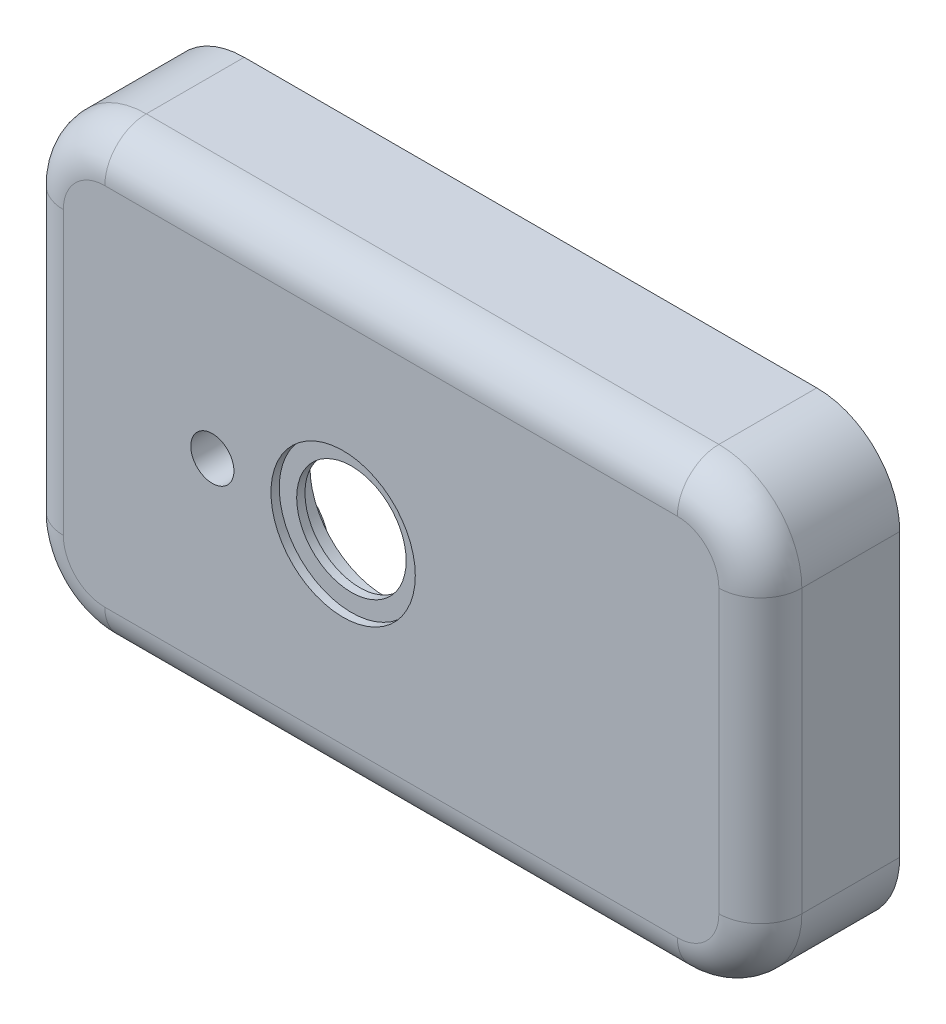
from build123d import *

# Parameters (mm, degrees)
BOSS_EXTRUDE1_DEPTH   = 14.8
BOSS_EXTRUDE1_2_DEPTH = 14.8
BOSS_EXTRUDE2_DEPTH   = 5
SKETCH3_W             = 5
SKETCH3_H             = 14.8
BOSS_EXTRUDE3_DEPTH   = 12
BOSS_EXTRUDE4_DEPTH   = 2
BOSS_EXTRUDE5_DEPTH   = 3
CUT_EXTRUDE1_DEPTH    = 10
FILLET1_R             = 5
SKETCH8_R             = 1.75
BOSS_EXTRUDE6_DEPTH   = 11.8
SKETCH9_R             = 1.75
CUT_EXTRUDE2_DEPTH    = 7
SKETCH10_R            = 2.75
CUT_EXTRUDE3_DEPTH    = 3.5
CUT_EXTRUDE4_DEPTH    = 9.5
CUT_EXTRUDE5_DEPTH    = 9.5
CUT_EXTRUDE6_DEPTH    = 2
SKETCH14_R            = 9
CUT_EXTRUDE7_DEPTH    = 3
CUT_EXTRUDE8_DEPTH    = 2
CHAMFER1_SIZE         = 5
CHAMFER2_SIZE         = 5
CHAMFER3_SIZE         = 5
CHAMFER4_SIZE         = 5
SKETCH16_W            = 31.273628052
SKETCH16_H            = 22.8
CUT_EXTRUDE9_DEPTH    = 4
SKETCH17_R            = 8.7
CUT_EXTRUDE10_DEPTH   = 1


with BuildPart() as part:
    # Sketch1 → Boss-Extrude1 (new body)
    with BuildSketch(Plane.XY):
        with BuildLine():
            Line((76.198643796, 78.202901291), (7.183009885, 78.202901291))
            ThreePointArc((7.183009885, 78.202901291), (0.111942073, 75.273969103), (-2.816990115, 68.202901291))
            Line((-2.816990115, 68.202901291), (-2.816990115, 55.811342077))
            Line((-2.816990115, 55.811342077), (2.183009885, 55.811342077))
            Line((2.183009885, 55.811342077), (2.183009885, 73.202901291))
            Line((2.183009885, 73.202901291), (81.198643796, 73.202901291))
            Line((81.198643796, 73.202901291), (81.198643796, 55.202901291))
            Line((81.198643796, 55.202901291), (86.198643796, 55.202901291))
            Line((86.198643796, 55.202901291), (86.198643796, 68.202901291))
            ThreePointArc((86.198643796, 68.202901291), (83.269711608, 75.273969103), (76.198643796, 78.202901291))
        make_face()
    extrude(amount=BOSS_EXTRUDE1_DEPTH)



with BuildPart() as body_2:
    # Sketch1 → Boss-Extrude1 2 (new body)
    with BuildSketch(Plane.XY):
        with BuildLine():
            Line((7.183009885, 24.202901291), (76.198643796, 24.202901291))
            ThreePointArc((76.198643796, 24.202901291), (83.269711608, 27.131833479), (86.198643796, 34.202901291))
            Line((86.198643796, 34.202901291), (86.198643796, 47.202901291))
            Line((86.198643796, 47.202901291), (81.198643796, 47.202901291))
            Line((81.198643796, 47.202901291), (81.198643796, 29.202901291))
            Line((81.198643796, 29.202901291), (2.183009885, 29.202901291))
            Line((2.183009885, 29.202901291), (2.183009885, 46.611342077))
            Line((2.183009885, 46.611342077), (-2.816990115, 46.611342077))
            Line((-2.816990115, 46.611342077), (-2.816990115, 34.202901291))
            ThreePointArc((-2.816990115, 34.202901291), (0.111942073, 27.131833479), (7.183009885, 24.202901291))
        make_face()
    extrude(amount=BOSS_EXTRUDE1_2_DEPTH)


with BuildPart() as part_1:
    add(part.part)

    add(body_2.part)  # Boss-Extrude2 merges body 2
    # Sketch2 → Boss-Extrude2 (add)
    with BuildSketch(Plane.ZY.offset(2.816990115)):
        with BuildLine():
            ThreePointArc((0, 46.611342077), (4.6, 51.211342077), (0, 55.811342077))
            Line((0, 55.811342077), (14.8, 55.811342077))
            Line((14.8, 55.811342077), (14.8, 46.611342077))
            Line((14.8, 46.611342077), (0, 46.611342077))
        make_face()
    extrude(amount=-BOSS_EXTRUDE2_DEPTH)

    # Sketch3 → Boss-Extrude3 (add)
    with BuildSketch(Plane(origin=(0, 47.202901291, 0), x_dir=(1, 0, 0), z_dir=(0, 1, 0))):
        with Locations((83.698643796, -7.4)):
            Rectangle(SKETCH3_W, SKETCH3_H)
    extrude(amount=BOSS_EXTRUDE3_DEPTH)

    # Sketch4 → Boss-Extrude4 (add)
    with BuildSketch(Plane.XY.offset(14.8)):
        with BuildLine():
            Line((86.198643796, 34.202901291), (86.198643796, 68.202901291))
            ThreePointArc((86.198643796, 68.202901291), (83.269711608, 75.273969103), (76.198643796, 78.202901291))
            Line((76.198643796, 78.202901291), (7.183009885, 78.202901291))
            ThreePointArc((7.183009885, 78.202901291), (0.111942073, 75.273969103), (-2.816990115, 68.202901291))
            Line((-2.816990115, 68.202901291), (-2.816990115, 34.202901291))
            ThreePointArc((-2.816990115, 34.202901291), (0.111942073, 27.131833479), (7.183009885, 24.202901291))
            Line((7.183009885, 24.202901291), (76.198643796, 24.202901291))
            ThreePointArc((76.198643796, 24.202901291), (83.269711608, 27.131833479), (86.198643796, 34.202901291))
        make_face()
    extrude(amount=BOSS_EXTRUDE4_DEPTH)

    # Sketch6 → Boss-Extrude5 (add)
    with BuildSketch(Plane(origin=(0, 0, 14.8), x_dir=(-1, 0, 0), z_dir=(0, 0, -1))):
        Polygon((-16.183009885, 58.202901291), (-2.183009885, 58.202901291), (-2.183009885, 73.202901291), (-81.198643796, 73.202901291), (-81.198643796, 59.527901291), (-80.198643796, 59.527901291), (-79.792394453, 59.527901291), (-54.598643796, 59.527901291), (-54.598643796, 42.877901291), (-80.198643796, 42.877901291), (-81.198643796, 42.877901291), (-81.198643796, 29.202901291), (-2.183009885, 29.202901291), (-2.183009885, 44.202901291), (-16.183009885, 44.202901291), align=None)
    extrude(amount=BOSS_EXTRUDE5_DEPTH)

    # Sketch7 → Cut-Extrude1 (cut)
    with BuildSketch(Plane(origin=(0, 0, 11.8), x_dir=(-1, 0, 0), z_dir=(0, 0, -1))):
        with BuildLine():
            ThreePointArc((-42.507165967, 51.202901291), (-35.907165967, 44.602901291), (-29.307165967, 51.202901291))
            Line((-29.307165967, 51.202901291), (-42.507165967, 51.202901291))
        make_face()
        with BuildLine():
            Line((-42.507165967, 51.202901291), (-29.307165967, 51.202901291))
            ThreePointArc((-29.307165967, 51.202901291), (-35.907165967, 57.802901291), (-42.507165967, 51.202901291))
        make_face()
        with BuildLine():
            ThreePointArc((-22.743355222, 51.202901291), (-20.143355222, 48.602901291), (-17.543355222, 51.202901291))
            Line((-17.543355222, 51.202901291), (-22.743355222, 51.202901291))
        make_face()
        with BuildLine():
            Line((-22.743355222, 51.202901291), (-17.543355222, 51.202901291))
            ThreePointArc((-17.543355222, 51.202901291), (-20.143355222, 53.802901291), (-22.743355222, 51.202901291))
        make_face()
    extrude(amount=-CUT_EXTRUDE1_DEPTH, mode=Mode.SUBTRACT)

    # Fillet1
    fillet1_edges = [part_1.edges().sort_by_distance(p)[0] for p in [
        (83.269711608, 27.131833479, 16.8),
        (86.198643796, 51.202901291, 16.8),
        (83.269711608, 75.273969103, 16.8),
        (41.690826841, 78.202901291, 16.8),
        (0.111942073, 75.273969103, 16.8),
        (-2.816990115, 51.202901291, 16.8),
        (0.111942073, 27.131833479, 16.8),
        (41.690826841, 24.202901291, 16.8),
    ]]
    fillet(fillet1_edges, radius=FILLET1_R)

    # Sketch13 → Cut-Extrude6 (cut)
    with BuildSketch(Plane(origin=(2.183009885, 0, 0), x_dir=(0, 0, -1), z_dir=(1, 0, 0))):
        Polygon((-10.1, 58.211342077), (-5.6, 58.211342077), (-5.6, 51.211342077), (-5.6, 44.211342077), (-10.1, 44.211342077), align=None)
    extrude(amount=-CUT_EXTRUDE6_DEPTH, mode=Mode.SUBTRACT)

    # Sketch14 → Cut-Extrude7 (cut)
    with BuildSketch(Plane(origin=(0, 0, 11.8), x_dir=(-1, 0, 0), z_dir=(0, 0, -1))):
        with Locations((-35.907165967, 51.202901291)):
            Circle(SKETCH14_R)
    extrude(amount=-CUT_EXTRUDE7_DEPTH, mode=Mode.SUBTRACT)

    # Sketch16 → Cut-Extrude9 (cut)
    with BuildSketch(Plane(origin=(0, 0, 11.8), x_dir=(-1, 0, 0), z_dir=(0, 0, -1))):
        with Locations((-65.56182977, 51.202901291)):
            Rectangle(SKETCH16_W, SKETCH16_H)
    extrude(amount=-CUT_EXTRUDE9_DEPTH, mode=Mode.SUBTRACT)

    # Sketch17 → Cut-Extrude10 (cut)
    with BuildSketch(Plane.XY.offset(16.8)):
        with Locations((35.907165967, 51.202901291)):
            Circle(SKETCH17_R)
    extrude(amount=-CUT_EXTRUDE10_DEPTH, mode=Mode.SUBTRACT)


with BuildPart() as body_2_2:
    # Sketch8 → Boss-Extrude6 (new body)
    # profile 1 of 8: a face of its own
    with BuildSketch(Plane(origin=(0, 0, 11.8), x_dir=(-1, 0, 0), z_dir=(0, 0, -1))):
        with BuildLine():
            Line((-81.198643796, 29.202901291), (-73.08039174, 29.202901291))
            ThreePointArc((-73.08039174, 29.202901291), (-72.64554409, 37.762369614), (-81.198643796, 38.308332867))
            Line((-81.198643796, 38.308332867), (-81.198643796, 29.202901291))
        make_face()
        with Locations((-77.198643796, 33.702901291)):
            Circle(SKETCH8_R, mode=Mode.SUBTRACT)
    # profile 2 of 8: a face of its own
    with BuildSketch(Plane(origin=(0, 0, 11.8), x_dir=(-1, 0, 0), z_dir=(0, 0, -1))):
        with Locations((-77.198643796, 33.702901291)):
            Circle(SKETCH8_R)
    # profile 3 of 8: a face of its own
    with BuildSketch(Plane(origin=(0, 0, 11.8), x_dir=(-1, 0, 0), z_dir=(0, 0, -1))):
        with BuildLine():
            ThreePointArc((-81.198643796, 64.097469715), (-72.64554409, 64.643432968), (-73.08039174, 73.202901291))
            Line((-73.08039174, 73.202901291), (-81.198643796, 73.202901291))
            Line((-81.198643796, 73.202901291), (-81.198643796, 64.097469715))
        make_face()
        with Locations((-77.198643796, 68.702901291)):
            Circle(SKETCH8_R, mode=Mode.SUBTRACT)
    # profile 4 of 8: a face of its own
    with BuildSketch(Plane(origin=(0, 0, 11.8), x_dir=(-1, 0, 0), z_dir=(0, 0, -1))):
        with Locations((-77.198643796, 68.702901291)):
            Circle(SKETCH8_R)
    # profile 5 of 8: a face of its own
    with BuildSketch(Plane(origin=(0, 0, 11.8), x_dir=(-1, 0, 0), z_dir=(0, 0, -1))):
        with BuildLine():
            ThreePointArc((-17.501261942, 73.202901291), (-13.383009885, 62.602901291), (-9.264757829, 73.202901291))
            Line((-9.264757829, 73.202901291), (-17.501261942, 73.202901291))
        make_face()
        with Locations((-13.383009885, 68.702901291)):
            Circle(SKETCH8_R, mode=Mode.SUBTRACT)
    # profile 6 of 8: a face of its own
    with BuildSketch(Plane(origin=(0, 0, 11.8), x_dir=(-1, 0, 0), z_dir=(0, 0, -1))):
        with Locations((-13.383009885, 68.702901291)):
            Circle(SKETCH8_R)
    # profile 7 of 8: a face of its own
    with BuildSketch(Plane(origin=(0, 0, 11.8), x_dir=(-1, 0, 0), z_dir=(0, 0, -1))):
        with BuildLine():
            Line((-17.501261942, 29.202901291), (-9.264757829, 29.202901291))
            ThreePointArc((-9.264757829, 29.202901291), (-13.383009885, 39.802901291), (-17.501261942, 29.202901291))
        make_face()
        with Locations((-13.383009885, 33.702901291)):
            Circle(SKETCH8_R, mode=Mode.SUBTRACT)
    # profile 8 of 8: a face of its own
    with BuildSketch(Plane(origin=(0, 0, 11.8), x_dir=(-1, 0, 0), z_dir=(0, 0, -1))):
        with Locations((-13.383009885, 33.702901291)):
            Circle(SKETCH8_R)
    extrude(amount=BOSS_EXTRUDE6_DEPTH)

    # Sketch9 → Cut-Extrude2 (cut)
    with BuildSketch(Plane(origin=(0, 0, 0), x_dir=(-1, 0, 0), z_dir=(0, 0, -1))):
        with Locations((-77.198643796, 68.702901291)):
            Circle(SKETCH9_R)
        with Locations((-77.198643796, 33.702901291)):
            Circle(SKETCH9_R)
        with Locations((-13.383009885, 68.702901291)):
            Circle(SKETCH9_R)
        with Locations((-13.383009885, 33.702901291)):
            Circle(SKETCH9_R)
    extrude(amount=-CUT_EXTRUDE2_DEPTH, mode=Mode.SUBTRACT)

    # Sketch10 → Cut-Extrude3 (cut)
    with BuildSketch(Plane(origin=(0, 0, 7), x_dir=(-1, 0, 0), z_dir=(0, 0, -1))):
        with Locations((-77.198643796, 68.702901291)):
            Circle(SKETCH10_R)
        with Locations((-77.198643796, 33.702901291)):
            Circle(SKETCH10_R)
        with Locations((-13.383009885, 68.702901291)):
            Circle(SKETCH10_R)
        with Locations((-13.383009885, 33.702901291)):
            Circle(SKETCH10_R)
    extrude(amount=-CUT_EXTRUDE3_DEPTH, mode=Mode.SUBTRACT)

    # Sketch11 → Cut-Extrude4 (cut)
    with BuildSketch(Plane(origin=(0, 33.702901291, 0), x_dir=(-1, 0, 0), z_dir=(0, -1, 0))):
        Polygon((-78.948643796, 0), (-78.948643796, -7), (-79.948643796, -7), (-79.948643796, -10.5), (-74.448643796, -10.5), (-74.448643796, -7), (-75.448643796, -7), (-75.448643796, 0), align=None)
        Polygon((-15.133009885, 0), (-15.133009885, -7), (-16.133009885, -7), (-16.133009885, -10.5), (-10.633009885, -10.5), (-10.633009885, -7), (-11.633009885, -7), (-11.633009885, 0), align=None)
    extrude(amount=-CUT_EXTRUDE4_DEPTH, mode=Mode.SUBTRACT)

    # Sketch12 → Cut-Extrude5 (cut)
    with BuildSketch(Plane(origin=(0, 68.702901291, 0), x_dir=(-1, 0, 0), z_dir=(0, -1, 0))):
        Polygon((-78.948643796, 0), (-78.948643796, -7), (-79.948643796, -7), (-79.948643796, -10.5), (-74.448643796, -10.5), (-74.448643796, -7), (-75.448643796, -7), (-75.448643796, 0), align=None)
        Polygon((-15.133009885, 0), (-15.133009885, -7), (-16.133009885, -7), (-16.133009885, -10.5), (-10.633009885, -10.5), (-10.633009885, -7), (-11.633009885, -7), (-11.633009885, 0), align=None)
    extrude(amount=CUT_EXTRUDE5_DEPTH, mode=Mode.SUBTRACT)

    # Sketch15 → Cut-Extrude8 (cut)
    with BuildSketch(Plane(origin=(0, 0, 0), x_dir=(-1, 0, 0), z_dir=(0, 0, -1))):
        with BuildLine():
            Line((-15.133009885, 33.702901291), (-15.133009885, 39.546487518))
            ThreePointArc((-15.133009885, 39.546487518), (-19.329146409, 35.06431983), (-17.501261942, 29.202901291))
            Line((-17.501261942, 29.202901291), (-9.264757829, 29.202901291))
            ThreePointArc((-9.264757829, 29.202901291), (-7.436873361, 35.06431983), (-11.633009885, 39.546487518))
            Line((-11.633009885, 39.546487518), (-11.633009885, 33.702901291))
            ThreePointArc((-11.633009885, 33.702901291), (-13.383009885, 31.952901291), (-15.133009885, 33.702901291))
        make_face()
        with BuildLine():
            Line((-75.448643796, 68.702901291), (-75.448643796, 62.859315063))
            ThreePointArc((-75.448643796, 62.859315063), (-71.252507272, 67.341482752), (-73.08039174, 73.202901291))
            Line((-73.08039174, 73.202901291), (-81.198643796, 73.202901291))
            Line((-81.198643796, 73.202901291), (-81.198643796, 64.097469715))
            ThreePointArc((-81.198643796, 64.097469715), (-80.139541913, 63.35864098), (-78.948643796, 62.859315063))
            Line((-78.948643796, 62.859315063), (-78.948643796, 68.702901291))
            ThreePointArc((-78.948643796, 68.702901291), (-77.198643796, 70.452901291), (-75.448643796, 68.702901291))
        make_face()
        with BuildLine():
            Line((-78.948643796, 33.702901291), (-78.948643796, 39.546487518))
            ThreePointArc((-78.948643796, 39.546487518), (-80.139541913, 39.047161601), (-81.198643796, 38.308332867))
            Line((-81.198643796, 38.308332867), (-81.198643796, 29.202901291))
            Line((-81.198643796, 29.202901291), (-73.08039174, 29.202901291))
            ThreePointArc((-73.08039174, 29.202901291), (-71.252507272, 35.06431983), (-75.448643796, 39.546487518))
            Line((-75.448643796, 39.546487518), (-75.448643796, 33.702901291))
            ThreePointArc((-75.448643796, 33.702901291), (-77.198643796, 31.952901291), (-78.948643796, 33.702901291))
        make_face()
        with BuildLine():
            Line((-11.633009885, 68.702901291), (-11.633009885, 62.859315063))
            ThreePointArc((-11.633009885, 62.859315063), (-7.436873361, 67.341482752), (-9.264757829, 73.202901291))
            Line((-9.264757829, 73.202901291), (-17.501261942, 73.202901291))
            ThreePointArc((-17.501261942, 73.202901291), (-19.329146409, 67.341482752), (-15.133009885, 62.859315063))
            Line((-15.133009885, 62.859315063), (-15.133009885, 68.702901291))
            ThreePointArc((-15.133009885, 68.702901291), (-13.383009885, 70.452901291), (-11.633009885, 68.702901291))
        make_face()
    extrude(amount=-CUT_EXTRUDE8_DEPTH, mode=Mode.SUBTRACT)

    # Chamfer1
    # the kernel refuses this chamfer: 5, 1 mm, written as the material it takes off along each edge
    with BuildSketch(Plane(origin=(10.633009885, 39.147853081, 7), x_dir=(-0.8514536354192476, -0.524429887336093, 0), z_dir=(0, 0, 1))) as chamfer1_piece_1:
        with BuildLine():
            Line((1.027995913, 0), (CHAMFER1_SIZE * 0.524429887336, CHAMFER1_SIZE * 0.851453635419))
            Line((CHAMFER1_SIZE * 0.524429887336, CHAMFER1_SIZE * 0.851453635419), (0, 0))
            ThreePointArc((0, 0), (0.479339794, -0.021595354), (1.027995913, 0))
        make_face()
    extrude(amount=3.5, mode=Mode.SUBTRACT)
    with BuildSketch(Plane(origin=(16.133009885, 39.147853081, 7), x_dir=(0.851453635419248, -0.5244298873360922, 0), z_dir=(0, 0, 1))) as chamfer1_piece_2:
        with BuildLine():
            Line((1.027995913, 0), (CHAMFER1_SIZE * 0.524429887336, -CHAMFER1_SIZE * 0.851453635419))
            Line((CHAMFER1_SIZE * 0.524429887336, -CHAMFER1_SIZE * 0.851453635419), (0, 0))
            ThreePointArc((0, 0), (0.479339794, 0.021595354), (1.027995913, 0))
        make_face()
    extrude(amount=3.5, mode=Mode.SUBTRACT)

    # Chamfer2
    # the kernel refuses this chamfer: 5, 1 mm, written as the material it takes off along each edge
    with BuildSketch(Plane(origin=(74.448643796, 39.147853081, 7), x_dir=(-0.851453635419248, -0.5244298873360922, 0), z_dir=(0, 0, 1))) as chamfer2_piece_1:
        with BuildLine():
            Line((1.027995913, 0), (CHAMFER2_SIZE * 0.524429887336, CHAMFER2_SIZE * 0.851453635419))
            Line((CHAMFER2_SIZE * 0.524429887336, CHAMFER2_SIZE * 0.851453635419), (0, 0))
            ThreePointArc((0, 0), (0.479339794, -0.021595354), (1.027995913, 0))
        make_face()
    extrude(amount=3.5, mode=Mode.SUBTRACT)
    with BuildSketch(Plane(origin=(79.948643796, 39.147853081, 7), x_dir=(0.8514536354192449, -0.5244298873360972, 0), z_dir=(0, 0, 1))) as chamfer2_piece_2:
        with BuildLine():
            Line((1.027995913, 0), (CHAMFER2_SIZE * 0.524429887336, -CHAMFER2_SIZE * 0.851453635419))
            Line((CHAMFER2_SIZE * 0.524429887336, -CHAMFER2_SIZE * 0.851453635419), (0, 0))
            ThreePointArc((0, 0), (0.479339794, 0.021595354), (1.027995913, 0))
        make_face()
    extrude(amount=3.5, mode=Mode.SUBTRACT)

    # Chamfer3
    # the kernel refuses this chamfer: 5, 1 mm, written as the material it takes off along each edge
    with BuildSketch(Plane(origin=(79.948643796, 63.2579495, 7), x_dir=(0.851453635419248, 0.5244298873360922, 0), z_dir=(0, 0, 1))) as chamfer3_piece_1:
        with BuildLine():
            Line((1.027995913, 0), (CHAMFER3_SIZE * 0.524429887336, CHAMFER3_SIZE * 0.851453635419))
            Line((CHAMFER3_SIZE * 0.524429887336, CHAMFER3_SIZE * 0.851453635419), (0, 0))
            ThreePointArc((0, 0), (0.479339794, -0.021595354), (1.027995913, 0))
        make_face()
    extrude(amount=3.5, mode=Mode.SUBTRACT)
    with BuildSketch(Plane(origin=(74.448643796, 63.2579495, 7), x_dir=(-0.8514536354192449, 0.5244298873360972, 0), z_dir=(0, 0, 1))) as chamfer3_piece_2:
        with BuildLine():
            Line((1.027995913, 0), (CHAMFER3_SIZE * 0.524429887336, -CHAMFER3_SIZE * 0.851453635419))
            Line((CHAMFER3_SIZE * 0.524429887336, -CHAMFER3_SIZE * 0.851453635419), (0, 0))
            ThreePointArc((0, 0), (0.479339794, 0.021595354), (1.027995913, 0))
        make_face()
    extrude(amount=3.5, mode=Mode.SUBTRACT)

    # Chamfer4
    # the kernel refuses this chamfer: 5, 1 mm, written as the material it takes off along each edge
    with BuildSketch(Plane(origin=(16.133009885, 63.2579495, 7), x_dir=(0.851453635419248, 0.5244298873360922, 0), z_dir=(0, 0, 1))) as chamfer4_piece_1:
        with BuildLine():
            Line((1.027995913, 0), (CHAMFER4_SIZE * 0.524429887336, CHAMFER4_SIZE * 0.851453635419))
            Line((CHAMFER4_SIZE * 0.524429887336, CHAMFER4_SIZE * 0.851453635419), (0, 0))
            ThreePointArc((0, 0), (0.479339794, -0.021595354), (1.027995913, 0))
        make_face()
    extrude(amount=3.5, mode=Mode.SUBTRACT)
    with BuildSketch(Plane(origin=(10.633009885, 63.2579495, 7), x_dir=(-0.8514536354192476, 0.524429887336093, 0), z_dir=(0, 0, 1))) as chamfer4_piece_2:
        with BuildLine():
            Line((1.027995913, 0), (CHAMFER4_SIZE * 0.524429887336, -CHAMFER4_SIZE * 0.851453635419))
            Line((CHAMFER4_SIZE * 0.524429887336, -CHAMFER4_SIZE * 0.851453635419), (0, 0))
            ThreePointArc((0, 0), (0.479339794, 0.021595354), (1.027995913, 0))
        make_face()
    extrude(amount=3.5, mode=Mode.SUBTRACT)


solid = Compound([part_1.part, body_2_2.part])
